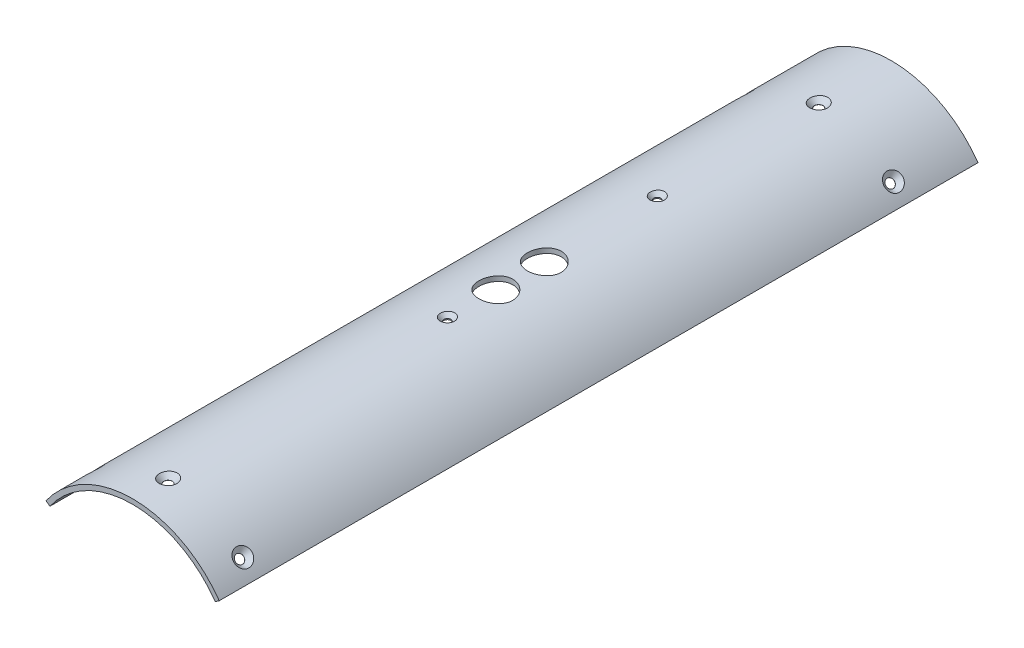
from build123d import *

# Parameters (mm, degrees)
IZIM1_R                                            = 65.5
IZIM1_R_2                                          = 62.5
EKSTR_ZYON_NCE1_DEPTH                              = 470
M5_ALT_GEN_ALYAN_HAV_A_BA_L_K_R_VID_2_COUNT        = 2
M5_ALT_GEN_ALYAN_HAV_A_BA_L_K_R_VID_2_PITCH        = 403
DAIRESEL_KAPLAMA1_COUNT                            = 8
M4_ALT_GEN_ALYAN_HAV_A_BA_L_K_R_VIDA_I_D           = 4.3
M4_ALT_GEN_ALYAN_HAV_A_BA_L_K_R_VIDA_I_DEPTH       = 11.5
M4_ALT_GEN_ALYAN_HAV_A_BA_L_K_R_VIDA_I_CSINK_D     = 8.96
M4_ALT_GEN_ALYAN_HAV_A_BA_L_K_R_VIDA_I_CSINK_ANGLE = 90
M4_ALT_GEN_ALYAN_HAV_A_BA_L_K_R_VIDA_I_TIP         = 1.291850331
DAIRESEL_KAPLAMA2_COUNT                            = 4
IZIM8_R                                            = 10.5
KES_EKSTR_ZYON1_DEPTH                              = 10
KES_EKSTR_ZYON3_DEPTH                              = 480.041230084


with BuildPart() as part:
    # Çizim1 → Ekstrüzyon-İnce1 (new body)
    with BuildSketch(Plane.XY):
        Circle(IZIM1_R)
        Circle(IZIM1_R_2, mode=Mode.SUBTRACT)
    extrude(amount=EKSTR_ZYON_NCE1_DEPTH)

    # Çizim3 → M5 Altıgen Alyan Havşa Başlı Kör Vida İçin Havşa1 (revolve, cut)
    with BuildSketch(Plane(origin=(0, 65.5, 45), x_dir=(0, 0, 1), z_dir=(1, 0, 0))):
        Polygon((0, 0), (0, 13.09228064), (2.65, 11.5), (2.65, 2.95), (5.6, 0), align=None)
    m5_alt_gen_alyan_hav_a_ba_l_k_r_vida_i = revolve(axis=Axis((0, 71.85, 45), (0, -1, 0)), mode=Mode.SUBTRACT)

    # M5 Alt_gen Alyan Hav_a Ba_l_ K_r Vid 2: M5 Altıgen Alyan Havşa Başlı Kör Vida İçin Havşa1 ×2
    with Locations(*[(0, 0, i * M5_ALT_GEN_ALYAN_HAV_A_BA_L_K_R_VID_2_PITCH) for i in range(1, M5_ALT_GEN_ALYAN_HAV_A_BA_L_K_R_VID_2_COUNT)]):
        add(m5_alt_gen_alyan_hav_a_ba_l_k_r_vida_i, mode=Mode.SUBTRACT)

    # Dairesel Kaplama1: M5 Altıgen Alyan Havşa Başlı Kör Vida İçin Havşa1 ×8 about axis
    dairesel_kaplama1_axis = Axis((0, 0, 470), (0, 0, 1))
    for i in range(1, DAIRESEL_KAPLAMA1_COUNT):
        add(m5_alt_gen_alyan_hav_a_ba_l_k_r_vida_i.rotate(dairesel_kaplama1_axis, i * 360 / DAIRESEL_KAPLAMA1_COUNT), mode=Mode.SUBTRACT)

    # Dairesel Kaplama1 copy 1 sketch → Dairesel Kaplama1 copy 1 (revolve, cut)
    with BuildSketch(Plane(origin=(-46.315494168, 46.315494168, 448), x_dir=(0, 0, 1), z_dir=(0.7071067811865476, 0.7071067811865475, 0))):
        Polygon((0, 0), (0, 13.09228064), (2.65, 11.5), (2.65, 2.95), (5.6, 0), align=None)
    revolve(axis=Axis((-50.805622228, 50.805622228, 448), (0.7071067811865475, -0.7071067811865476, 0)), mode=Mode.SUBTRACT)

    # Dairesel Kaplama1 copy 2 sketch → Dairesel Kaplama1 copy 2 (revolve, cut)
    with BuildSketch(Plane(origin=(-65.5, 0, 448), x_dir=(0, 0, 1), z_dir=(0, 1, 0))):
        Polygon((0, 0), (0, 13.09228064), (2.65, 11.5), (2.65, 2.95), (5.6, 0), align=None)
    revolve(axis=Axis((-71.85, 0, 448), (1, 0, 0)), mode=Mode.SUBTRACT)

    # Dairesel Kaplama1 copy 3 sketch → Dairesel Kaplama1 copy 3 (revolve, cut)
    with BuildSketch(Plane(origin=(-46.315494168, -46.315494168, 448), x_dir=(0, 0, 1), z_dir=(-0.7071067811865475, 0.7071067811865476, 0))):
        Polygon((0, 0), (0, 13.09228064), (2.65, 11.5), (2.65, 2.95), (5.6, 0), align=None)
    revolve(axis=Axis((-50.805622228, -50.805622228, 448), (0.7071067811865476, 0.7071067811865475, 0)), mode=Mode.SUBTRACT)

    # Dairesel Kaplama1 copy 4 sketch → Dairesel Kaplama1 copy 4 (revolve, cut)
    with BuildSketch(Plane(origin=(0, -65.5, 448), x_dir=(0, 0, 1), z_dir=(-1, 0, 0))):
        Polygon((0, 0), (0, 13.09228064), (2.65, 11.5), (2.65, 2.95), (5.6, 0), align=None)
    revolve(axis=Axis((0, -71.85, 448), (0, 1, 0)), mode=Mode.SUBTRACT)

    # Dairesel Kaplama1 copy 5 sketch → Dairesel Kaplama1 copy 5 (revolve, cut)
    with BuildSketch(Plane(origin=(46.315494168, -46.315494168, 448), x_dir=(0, 0, 1), z_dir=(-0.7071067811865477, -0.7071067811865475, 0))):
        Polygon((0, 0), (0, 13.09228064), (2.65, 11.5), (2.65, 2.95), (5.6, 0), align=None)
    revolve(axis=Axis((50.805622228, -50.805622228, 448), (-0.7071067811865475, 0.7071067811865477, 0)), mode=Mode.SUBTRACT)

    # Dairesel Kaplama1 copy 6 sketch → Dairesel Kaplama1 copy 6 (revolve, cut)
    with BuildSketch(Plane(origin=(65.5, 0, 448), x_dir=(0, 0, 1), z_dir=(0, -1, 0))):
        Polygon((0, 0), (0, 13.09228064), (2.65, 11.5), (2.65, 2.95), (5.6, 0), align=None)
    revolve(axis=Axis((71.85, 0, 448), (-1, 0, 0)), mode=Mode.SUBTRACT)

    # Dairesel Kaplama1 copy 7 sketch → Dairesel Kaplama1 copy 7 (revolve, cut)
    with BuildSketch(Plane(origin=(46.315494168, 46.315494168, 448), x_dir=(0, 0, 1), z_dir=(0.7071067811865474, -0.7071067811865477, 0))):
        Polygon((0, 0), (0, 13.09228064), (2.65, 11.5), (2.65, 2.95), (5.6, 0), align=None)
    revolve(axis=Axis((50.805622228, 50.805622228, 448), (-0.7071067811865477, -0.7071067811865474, 0)), mode=Mode.SUBTRACT)

    # M4 Alt_gen Alyan Hav_a Ba_l_ K_r Vida _i
    with Locations(Plane(origin=(0, 65.5, 0), x_dir=(1, 0, 0), z_dir=(0, 1, 0))):
        with Locations((0, -275)):
            CounterSinkHole(M4_ALT_GEN_ALYAN_HAV_A_BA_L_K_R_VIDA_I_D / 2, M4_ALT_GEN_ALYAN_HAV_A_BA_L_K_R_VIDA_I_CSINK_D / 2, depth=M4_ALT_GEN_ALYAN_HAV_A_BA_L_K_R_VIDA_I_DEPTH, counter_sink_angle=M4_ALT_GEN_ALYAN_HAV_A_BA_L_K_R_VIDA_I_CSINK_ANGLE)
            with Locations((0, 0, -(M4_ALT_GEN_ALYAN_HAV_A_BA_L_K_R_VIDA_I_DEPTH + M4_ALT_GEN_ALYAN_HAV_A_BA_L_K_R_VIDA_I_TIP / 2))):  # 118° drill point
                Cone(0, M4_ALT_GEN_ALYAN_HAV_A_BA_L_K_R_VIDA_I_D / 2, M4_ALT_GEN_ALYAN_HAV_A_BA_L_K_R_VIDA_I_TIP, mode=Mode.SUBTRACT)

    # Çizim7 → M4 Alt_gen Alyan Hav_a Ba_l_ K_r Vid 2 (revolve, cut)
    with BuildSketch(Plane(origin=(0, 65.5, 145), x_dir=(0, 0, 1), z_dir=(1, 0, 0))):
        Polygon((0, 0), (0, 12.791850331), (2.15, 11.5), (2.15, 2.33), (4.48, 0), align=None)
    m4_alt_gen_alyan_hav_a_ba_l_k_r_vid_2 = revolve(axis=Axis((0, 71.85, 145), (0, -1, 0)), mode=Mode.SUBTRACT)

    # Dairesel Kaplama2: M4 Alt_gen Alyan Hav_a Ba_l_ K_r Vid 2 ×4 about axis
    dairesel_kaplama2_axis = Axis((0, 0, 470), (0, 0, 1))
    for i in range(1, DAIRESEL_KAPLAMA2_COUNT):
        add(m4_alt_gen_alyan_hav_a_ba_l_k_r_vid_2.rotate(dairesel_kaplama2_axis, i * 360 / DAIRESEL_KAPLAMA2_COUNT), mode=Mode.SUBTRACT)

    # Çizim8 → Kes-Ekstrüzyon1 (cut)
    with BuildSketch(Plane(origin=(0, 65.5, 0), x_dir=(1, 0, 0), z_dir=(0, 1, 0))):
        with Locations((0, -245)):
            Circle(IZIM8_R)
        with Locations((0, -215)):
            Circle(IZIM8_R)
    extrude(amount=-KES_EKSTR_ZYON1_DEPTH, mode=Mode.SUBTRACT)

    # Çizim12 → Kes-Ekstrüzyon3 (cut, through all)
    with BuildSketch(Plane(origin=(0, 0, 0), x_dir=(-1, 0, 0), z_dir=(0, 0, -1))):
        with BuildLine():
            Line((-53.654458901, 37.569256581), (-51.197002768, 35.848527272))
            ThreePointArc((-51.197002768, 35.848527272), (0, -62.5), (51.197002768, 35.848527272))
            Line((51.197002768, 35.848527272), (53.654458901, 37.569256581))
            ThreePointArc((53.654458901, 37.569256581), (0, -65.5), (-53.654458901, 37.569256581))
        make_face()
    extrude(amount=-KES_EKSTR_ZYON3_DEPTH, mode=Mode.SUBTRACT)


solid = part.part
